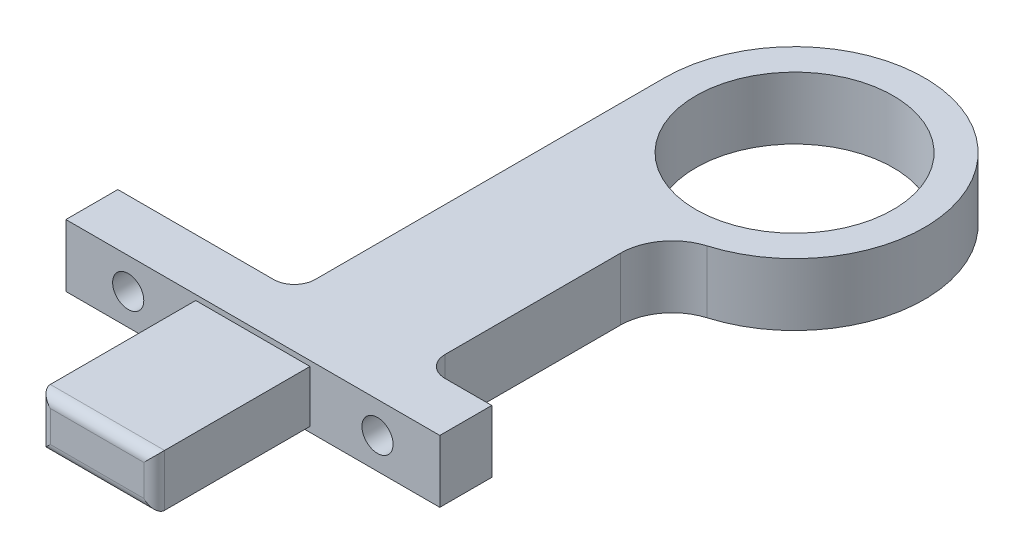
from build123d import *

# Parameters (mm, degrees)
CROQUIS1_R              = 9.5
SALIENTE_EXTRUIR1_DEPTH = 6
CROQUIS2_R              = 1.5
CORTAR_EXTRUIR1_DEPTH   = 6
CROQUIS3_W              = 11
CROQUIS3_H              = 15
CORTAR_EXTRUIR2_DEPTH   = 0.5
CROQUIS4_W              = 11
CROQUIS4_H              = 15
CORTAR_EXTRUIR3_DEPTH   = 0.5
REDONDEO1_R             = 1


with BuildPart() as part:
    # Croquis1 → Saliente-Extruir1 (new body)
    with BuildSketch(Plane(origin=(0, 0, 0), x_dir=(1, 0, 0), z_dir=(0, 1, 0))):
        with BuildLine():
            Line((-42, -19), (-29.5, -19))
            Line((-29.5, -19), (-29.5, -34))
            Line((-29.5, -34), (-18.5, -34))
            Line((-18.5, -34), (-18.5, -19))
            Line((-18.5, -19), (-6, -19))
            Line((-6, -19), (-6, -14))
            Line((-6, -14), (-10.5, -14))
            ThreePointArc((-10.5, -14), (-11.914213562, -13.414213562), (-12.5, -12))
            Line((-12.5, -12), (-12.5, 4.880125263))
            ThreePointArc((-12.5, 4.880125263), (-11.508918629, 7.868196787), (-8.928571429, 9.671699501))
            ThreePointArc((-8.928571429, 9.671699501), (-5.029821192, 31.672931666), (-25, 21.650635095))
            Line((-25, 21.650635095), (-25, -12))
            ThreePointArc((-25, -12), (-25.585786438, -13.414213562), (-27, -14))
            Line((-27, -14), (-42, -14))
            Line((-42, -14), (-42, -19))
        make_face()
        with Locations((-12.5, 21.650635095)):
            Circle(CROQUIS1_R, mode=Mode.SUBTRACT)
    extrude(amount=SALIENTE_EXTRUIR1_DEPTH)

    # Croquis2 → Cortar-Extruir1 (cut)
    with BuildSketch(Plane.XY.offset(19)):
        with Locations((-36, 3)):
            Circle(CROQUIS2_R)
        with Locations((-12, 3)):
            Circle(CROQUIS2_R)
    extrude(amount=-CORTAR_EXTRUIR1_DEPTH, mode=Mode.SUBTRACT)

    # Croquis3 → Cortar-Extruir2 (cut)
    with BuildSketch(Plane(origin=(0, 6, 0), x_dir=(1, 0, 0), z_dir=(0, 1, 0))):
        with Locations((-24, -26.5)):
            Rectangle(CROQUIS3_W, CROQUIS3_H)
    extrude(amount=-CORTAR_EXTRUIR2_DEPTH, mode=Mode.SUBTRACT)

    # Croquis4 → Cortar-Extruir3 (cut)
    with BuildSketch(Plane.XZ):
        with Locations((-24, 26.5)):
            Rectangle(CROQUIS4_W, CROQUIS4_H)
    extrude(amount=-CORTAR_EXTRUIR3_DEPTH, mode=Mode.SUBTRACT)

    # Redondeo1
    redondeo1_edges = [part.edges().sort_by_distance(p)[0] for p in [
        (-29.5, 3, 34),
        (-24, 5.5, 34),
        (-18.5, 3, 34),
        (-24, 0.5, 34),
    ]]
    fillet(redondeo1_edges, radius=REDONDEO1_R)


solid = part.part
